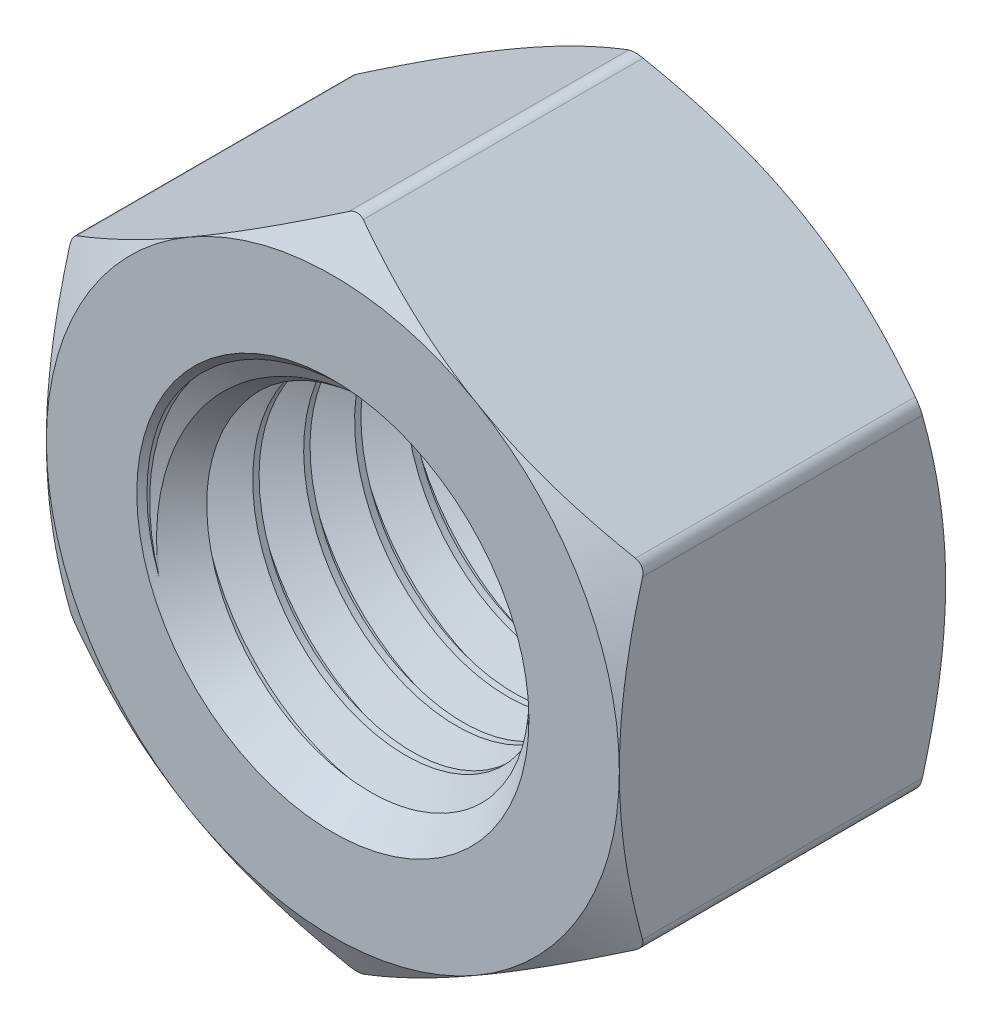
from build123d import *

# Parameters (mm, degrees)
BOSS_EXTRUDE2_DEPTH     = 8.1359375
CUT_EXTRUDE4_DEPTH      = 24.291694019
CUT_EXTRUDE4_DEPTH_BACK = 24.291694019
SKETCH16_R              = 9.525
SKETCH7_OUTSIDE_W       = 137.658
SKETCH7_OUTSIDE_H       = 142.08
SKETCH7_OUTSIDE_R       = 14.2875
CUT_EXTRUDE5_DEPTH      = 28.22284789
CUT_EXTRUDE5_DRAFT      = -60
MIRROR4_COPY_1_SKETCH_W = 137.658
MIRROR4_COPY_1_SKETCH_H = 142.08
MIRROR4_COPY_1_SKETCH_R = 14.2875
MIRROR4_COPY_1_DEPTH    = 28.22284789
MIRROR4_COPY_1_DRAFT    = -60
FILLET2_R               = 0.714375
SKETCH13_R              = 9.525
BOSS_EXTRUDE1_DEPTH     = 16.271875
CUT_SWEEP1_PITCH        = 2.54
SKETCH17_R              = 9.525
BOSS_EXTRUDE3_DEPTH     = 16.271875


with BuildPart() as part:
    # Sketch15 → Boss-Extrude2 (new, symmetric)
    with BuildSketch(Plane.XY):
        Polygon((0, 16.497783942), (-14.2875, 8.248891971), (-14.2875, -8.248891971), (0, -16.497783942), (14.2875, -8.248891971), (14.2875, 8.248891971), align=None)
    extrude(amount=BOSS_EXTRUDE2_DEPTH, both=True)

    # Sketch16 → Cut-Extrude4 (cut, two sides: drawn at the far end of the back side and taken through both)
    with BuildSketch(Plane.XY.offset(-CUT_EXTRUDE4_DEPTH_BACK)):
        Circle(SKETCH16_R)
    extrude(amount=CUT_EXTRUDE4_DEPTH + CUT_EXTRUDE4_DEPTH_BACK, mode=Mode.SUBTRACT)


with BuildPart() as cut_extrude5_tool:
    # Sketch7 outside → Cut-Extrude5 (with draft: the straight prism first)
    with BuildSketch(Plane.XY.offset(8.1359375)):
        Rectangle(SKETCH7_OUTSIDE_W, SKETCH7_OUTSIDE_H)
        Circle(SKETCH7_OUTSIDE_R, mode=Mode.SUBTRACT)
    extrude(amount=-CUT_EXTRUDE5_DEPTH)
    # Cut-Extrude5: the draft: its side faces are tilted about the plane it starts from
    cut_extrude5_sides = [cut_extrude5_tool.faces().sort_by_distance(p)[0] for p in [
        (0, -71.04, -5.975486445),
        (68.829, 0, -5.975486445),
        (0, 71.04, -5.975486445),
        (-68.829, 0, -5.975486445),
        (-14.2875, 0, -5.975486445),
    ]]
    draft(cut_extrude5_sides, Plane.XY.offset(8.1359375), CUT_EXTRUDE5_DRAFT)


with BuildPart() as part_1:
    add(part.part)

    # Cut-Extrude5: cut by cut_extrude5_tool
    add(cut_extrude5_tool.part, mode=Mode.SUBTRACT)


with BuildPart() as mirror4_copy_1_tool:
    # Mirror4 copy 1 sketch → Mirror4 copy 1 (with draft: the straight prism first)
    with BuildSketch(Plane(origin=(0, 0, -8.1359375), x_dir=(1, 0, 0), z_dir=(0, 0, -1))):
        Rectangle(MIRROR4_COPY_1_SKETCH_W, MIRROR4_COPY_1_SKETCH_H)
        Circle(MIRROR4_COPY_1_SKETCH_R, mode=Mode.SUBTRACT)
    extrude(amount=-MIRROR4_COPY_1_DEPTH)
    # Mirror4 copy 1: the draft: its side faces are tilted about the plane it starts from
    mirror4_copy_1_sides = [mirror4_copy_1_tool.faces().sort_by_distance(p)[0] for p in [
        (0, -71.04, 5.975486445),
        (68.829, 0, 5.975486445),
        (0, 71.04, 5.975486445),
        (-68.829, 0, 5.975486445),
        (-14.2875, 0, 5.975486445),
    ]]
    draft(mirror4_copy_1_sides, Plane(origin=(0, 0, -8.1359375), x_dir=(1, 0, 0), z_dir=(0, 0, -1)), MIRROR4_COPY_1_DRAFT)


with BuildPart() as part_2:
    add(part_1.part)

    # Mirror4 copy 1: cut by mirror4_copy_1_tool
    add(mirror4_copy_1_tool.part, mode=Mode.SUBTRACT)

    # Fillet2
    fillet2_edges = [part_2.edges().sort_by_distance(p)[0] for p in [
        (-14.2875, 8.248891971, 0),
        (-14.2875, -8.248891971, 0),
        (0, -16.497783942, 0),
        (14.2875, -8.248891971, 0),
        (14.2875, 8.248891971, 0),
        (0, 16.497783942, 0),
    ]]
    fillet(fillet2_edges, radius=FILLET2_R)

    # Sketch17 → Boss-Extrude3 (add)
    with BuildSketch(Plane.XY.offset(8.1359375)):
        Circle(SKETCH17_R)
    extrude(amount=-BOSS_EXTRUDE3_DEPTH)


with BuildPart() as body_2:
    # Sketch13 → Boss-Extrude1 (new body)
    with BuildSketch(Plane(origin=(0, 0, -8.1359375), x_dir=(-1, 0, 0), z_dir=(0, 0, -1))):
        Circle(SKETCH13_R)
    extrude(amount=-BOSS_EXTRUDE1_DEPTH)

    # Cut-Sweep1: the profile of Sketch12 profile screwed along a right-hand helix of 7.40625 turns, 10 arcs to a turn; built about Z, then put on its axis
    cut_sweep1_z = Axis((0, 0, 0), (0, 0, 1))
    cut_sweep1_corners = [(9.5253, 0, -2.222673205), (9.5253, 0, 0.000173205), (7.875221606, 0, -0.9525), (7.875221606, 0, -1.27)]
    with BuildLine(mode=Mode.PRIVATE) as cut_sweep1_profile:
        Line(cut_sweep1_corners[0], cut_sweep1_corners[1])
        Line(cut_sweep1_corners[1], cut_sweep1_corners[2])
        Line(cut_sweep1_corners[2], cut_sweep1_corners[3])
        Line(cut_sweep1_corners[3], cut_sweep1_corners[0])
    cut_sweep1_cap = Face(cut_sweep1_profile.wire())
    cut_sweep1_turn_angles = [0, 18, 36, 54, 72, 90, 108, 126, 144, 162, 180, 198, 216, 234, 252, 270, 288, 306, 324, 342, 360]
    cut_sweep1_turn_weights = [1, 0.9510565162951535, 1, 0.9510565162951535, 1, 0.9510565162951535, 1, 0.9510565162951535, 1, 0.9510565162951535, 1, 0.9510565162951535, 1, 0.9510565162951535, 1, 0.9510565162951535, 1, 0.9510565162951535, 1, 0.9510565162951535, 1]
    cut_sweep1_turn_rails = [Edge.make_bspline([Vector(p[0], p[1], 0).rotate(cut_sweep1_z, cut_sweep1_turn_angles[k]) / cut_sweep1_turn_weights[k] + Vector(0, 0, p[2] + CUT_SWEEP1_PITCH * cut_sweep1_turn_angles[k] / 360) for k in range(21)], [0, 0, 0, 1, 1, 2, 2, 3, 3, 4, 4, 5, 5, 6, 6, 7, 7, 8, 8, 9, 9, 10, 10, 10], 2, cut_sweep1_turn_weights) for p in cut_sweep1_corners]
    cut_sweep1_turn_sides = [Face.make_surface_from_curves(cut_sweep1_turn_rails[p[0]], cut_sweep1_turn_rails[p[1]]) for p in [(0, 1), (1, 2), (2, 3), (3, 0)]]
    cut_sweep1_last_angles = [2520, 2538, 2556, 2574, 2592, 2610, 2628, 2646, 2664, 2665.125, 2666.25]
    cut_sweep1_last_weights = [1, 0.9510565162951535, 1, 0.9510565162951535, 1, 0.9510565162951535, 1, 0.9510565162951535, 1, 0.9998072404820623, 1]
    cut_sweep1_last_rails = [Edge.make_bspline([Vector(p[0], p[1], 0).rotate(cut_sweep1_z, cut_sweep1_last_angles[k]) / cut_sweep1_last_weights[k] + Vector(0, 0, p[2] + CUT_SWEEP1_PITCH * cut_sweep1_last_angles[k] / 360) for k in range(11)], [0, 0, 0, 1, 1, 2, 2, 3, 3, 4, 4, 5, 5, 5], 2, cut_sweep1_last_weights) for p in cut_sweep1_corners]
    cut_sweep1_last_sides = [Face.make_surface_from_curves(cut_sweep1_last_rails[p[0]], cut_sweep1_last_rails[p[1]]) for p in [(0, 1), (1, 2), (2, 3), (3, 0)]]
    cut_sweep1 = Plane(origin=(0, 0, -8.1359375), x_dir=(0, 1, 0), z_dir=(0, 0, 1)) * Solid(Shell([*[p.moved(Location((0, 0, CUT_SWEEP1_PITCH * i))) for i in range(7) for p in cut_sweep1_turn_sides], *cut_sweep1_last_sides, cut_sweep1_cap, cut_sweep1_cap.rotate(cut_sweep1_z, 2666.25).moved(Location((0, 0, CUT_SWEEP1_PITCH * 2666.25 / 360)))]))
    add(cut_sweep1, mode=Mode.SUBTRACT)


with BuildPart() as part_3:
    add(part_2.part)

    # Combine1: cut body 2
    add(body_2.part, mode=Mode.SUBTRACT)

    # Cut-Extrude2 cone 1 section (through the dimple's axis) → Cut-Extrude2 (revolve, cut)
    with BuildSketch(Plane(origin=(0, 0, 8.1359375), x_dir=(0, -1, 0), z_dir=(1, 0, 0))):
        Polygon((0, 0), (9.779, 0), (0, 9.779), align=None)
    revolve(axis=Axis((0, 0, 8.1359375), (0, 0, -1)), mode=Mode.SUBTRACT)

    # Cut-Extrude3 cone 1 section (through the dimple's axis) → Cut-Extrude3 (revolve, cut)
    with BuildSketch(Plane(origin=(0, 0, -8.1359375), x_dir=(0, 1, 0), z_dir=(1, 0, 0))):
        Polygon((0, 0), (9.779, 0), (0, 9.779), align=None)
    revolve(axis=Axis((0, 0, -8.1359375), (0, 0, 1)), mode=Mode.SUBTRACT)


solid = part_3.part
